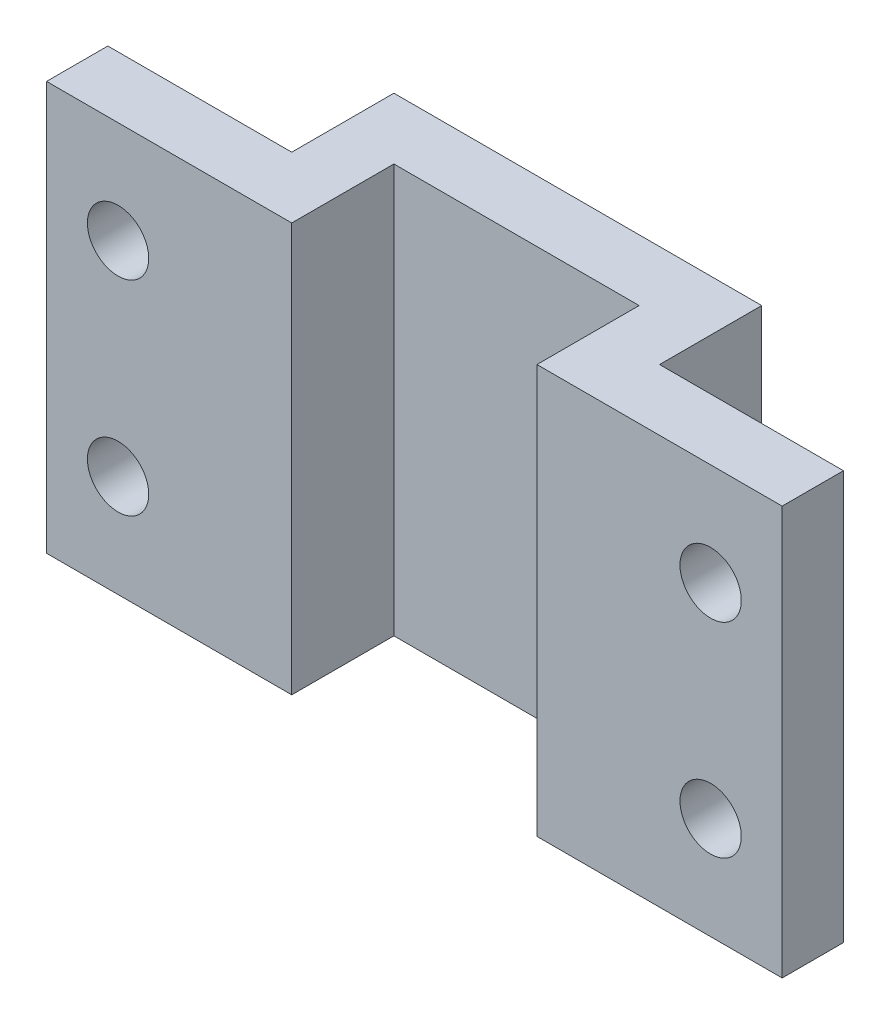
from build123d import *

# Parameters (mm, degrees)
BOSS_EXTRUDE1_DEPTH = 20
SKETCH2_R           = 1.5
CUT_EXTRUDE1_DEPTH  = 16


with BuildPart() as part:
    # Sketch1 → Boss-Extrude1 (new body)
    with BuildSketch(Plane(origin=(0, 0, 0), x_dir=(1, 0, 0), z_dir=(0, 1, 0))):
        Polygon((16.470422535, -3), (28.470422535, -3), (28.470422535, 0), (19.470422535, 0), (19.470422535, 5), (1.470422535, 5), (1.470422535, 0), (-7.529577465, 0), (-7.529577465, -3), (4.470422535, -3), (4.470422535, 2), (16.470422535, 2), align=None)
    extrude(amount=BOSS_EXTRUDE1_DEPTH)

    # Sketch2 → Cut-Extrude1 (cut)
    with BuildSketch(Plane(origin=(0, 0, 0), x_dir=(-1, 0, 0), z_dir=(0, 0, -1))):
        with Locations((4.029577465, 15)):
            Circle(SKETCH2_R)
        with Locations((4.029577465, 5)):
            Circle(SKETCH2_R)
        with Locations((-24.970422535, 5)):
            Circle(SKETCH2_R)
        with Locations((-24.970422535, 15)):
            Circle(SKETCH2_R)
    extrude(amount=-CUT_EXTRUDE1_DEPTH, mode=Mode.SUBTRACT)


solid = part.part
